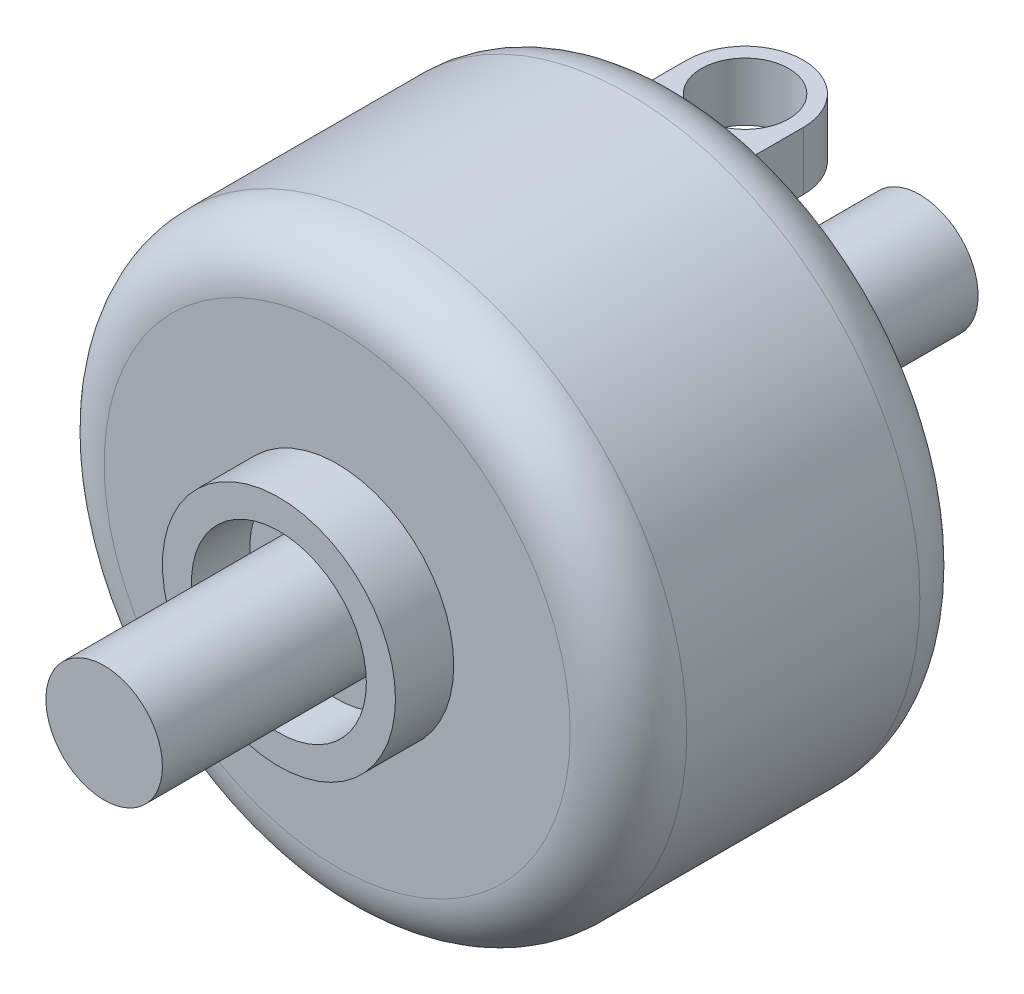
from build123d import *

# Parameters (mm, degrees)
SKETCH1_R           = 25
BOSS_EXTRUDE1_DEPTH = 30
SKETCH2_R           = 10
BOSS_EXTRUDE2_DEPTH = 20
SKETCH3_R           = 7.5
CUT_EXTRUDE1_DEPTH  = 20
SKETCH4_R           = 5
BOSS_EXTRUDE3_DEPTH = 20
BOSS_EXTRUDE4_START = 5
SKETCH5_R           = 10
BOSS_EXTRUDE4_DEPTH = 5
SKETCH7_W           = 10
SKETCH7_H           = 5
BOSS_EXTRUDE5_DEPTH = 10
SKETCH8_R           = 3.75
CUT_EXTRUDE2_DEPTH  = 5
CUT_EXTRUDE3_START  = -5
SKETCH9_R           = 3.75
CUT_EXTRUDE3_DEPTH  = 5
FILLET1_R           = 5
FILLET2_R           = 5
CUT_EXTRUDE4_START  = -15
SKETCH10_R          = 10
SKETCH10_R_2        = 7.5
CUT_EXTRUDE4_DEPTH  = 15
CUT_EXTRUDE5_START  = -5
SKETCH11_R          = 7.5
CUT_EXTRUDE5_DEPTH  = 5
BOSS_EXTRUDE6_START = 20
SKETCH12_R          = 5
BOSS_EXTRUDE6_DEPTH = 20


# Some blends are built 0.0001 mm under size
with BuildPart() as part:
    # Sketch1 → Boss-Extrude1 (new body)
    with BuildSketch(Plane.XY):
        Circle(SKETCH1_R)
    extrude(amount=BOSS_EXTRUDE1_DEPTH)

    # Sketch2 → Boss-Extrude2 (add)
    with BuildSketch(Plane.XY.offset(30)):
        Circle(SKETCH2_R)
    extrude(amount=BOSS_EXTRUDE2_DEPTH)

    # Sketch3 → Cut-Extrude1 (cut)
    with BuildSketch(Plane.XY.offset(50)):
        Circle(SKETCH3_R)
    extrude(amount=-CUT_EXTRUDE1_DEPTH, mode=Mode.SUBTRACT)

    # Sketch4 → Boss-Extrude3 (add)
    with BuildSketch(Plane.XY.offset(30)):
        Circle(SKETCH4_R)
    extrude(amount=BOSS_EXTRUDE3_DEPTH)

    # Sketch5 → Boss-Extrude4 (add)
    with BuildSketch(Plane(origin=(0, 0, 0), x_dir=(-1, 0, 0), z_dir=(0, 0, -1)).offset(BOSS_EXTRUDE4_START)):
        with Locations(Location((0, 0, 0), (0, 0, 180))):
            Circle(SKETCH5_R)
    extrude(amount=-BOSS_EXTRUDE4_DEPTH)

    # Sketch7 → Boss-Extrude5 (add)
    with BuildSketch(Plane(origin=(0, 0, 0), x_dir=(-1, 0, 0), z_dir=(0, 0, -1))):
        with Locations((0, 17.5)):
            Rectangle(SKETCH7_W, SKETCH7_H)
        with Locations((0, -17.5)):
            Rectangle(SKETCH7_W, SKETCH7_H)
    extrude(amount=BOSS_EXTRUDE5_DEPTH)

    # Sketch8 → Cut-Extrude2 (cut)
    with BuildSketch(Plane(origin=(0, 20, 0), x_dir=(1, 0, 0), z_dir=(0, 1, 0))):
        with Locations(Location((0, 5, 0), (0, 0, 180))):
            Circle(SKETCH8_R)
    extrude(amount=-CUT_EXTRUDE2_DEPTH, mode=Mode.SUBTRACT)

    # Sketch9 → Cut-Extrude3 (cut)
    with BuildSketch(Plane(origin=(0, -20, 0), x_dir=(-1, 0, 0), z_dir=(0, -1, 0)).offset(CUT_EXTRUDE3_START)):
        with Locations((0, 5)):
            Circle(SKETCH9_R)
    extrude(amount=CUT_EXTRUDE3_DEPTH, mode=Mode.SUBTRACT)

    # Fillet1
    # the kernel refuses this fillet: 5 mm, written as the material it takes off along each edge
    with BuildSketch(Plane(origin=(0, 0, 30), x_dir=(1, 0, 0), z_dir=(0, -1, 0))) as fillet1_piece_1:
        with BuildLine():
            CenterArc((25 - FILLET1_R, -FILLET1_R), FILLET1_R, 0, 90)
            Line((25 - FILLET1_R, 0), (25, 0))
            Line((25, 0), (25, -FILLET1_R))
        make_face()
    revolve(axis=Axis((0, 0, 30), (0, 0, 1)), mode=Mode.SUBTRACT)
    with BuildSketch(Plane(origin=(0, 0, 0), x_dir=(1, 0, 0), z_dir=(0, -1, 0))) as fillet1_piece_2_section:
        with BuildLine():
            CenterArc((25 - FILLET1_R, FILLET1_R), FILLET1_R, 270, 90)
            Line((25 - FILLET1_R, 0), (25, 0))
            Line((25, 0), (25, FILLET1_R))
        make_face()
    fillet1_piece_2 = revolve(axis=Axis((0, 0, 0), (0, 0, 1)), mode=Mode.PRIVATE)
    fillet1_piece_2 = split(fillet1_piece_2, bisect_by=Plane(origin=(5, 14.511659558, 1.419610571), z_dir=(1, 0, 0)), keep=Keep.TOP, mode=Mode.PRIVATE)
    add(fillet1_piece_2, mode=Mode.SUBTRACT)
    with BuildSketch(Plane(origin=(0, 0, 0), x_dir=(1, 0, 0), z_dir=(0, -1, 0))) as fillet1_piece_3_section:
        with BuildLine():
            CenterArc((25 - FILLET1_R, FILLET1_R), FILLET1_R, 270, 90)
            Line((25 - FILLET1_R, 0), (25, 0))
            Line((25, 0), (25, FILLET1_R))
        make_face()
    fillet1_piece_3 = revolve(axis=Axis((0, 0, 0), (0, 0, 1)), mode=Mode.PRIVATE)
    fillet1_piece_3 = split(fillet1_piece_3, bisect_by=Plane(origin=(4.6e-08, 20, 1.116734198), z_dir=(0, 1, 0)), keep=Keep.TOP, mode=Mode.PRIVATE)
    add(fillet1_piece_3, mode=Mode.SUBTRACT)
    with BuildSketch(Plane(origin=(0, 0, 0), x_dir=(1, 0, 0), z_dir=(0, -1, 0))) as fillet1_piece_4_section:
        with BuildLine():
            CenterArc((25 - FILLET1_R, FILLET1_R), FILLET1_R, 270, 90)
            Line((25 - FILLET1_R, 0), (25, 0))
            Line((25, 0), (25, FILLET1_R))
        make_face()
    fillet1_piece_4 = revolve(axis=Axis((0, 0, 0), (0, 0, 1)), mode=Mode.PRIVATE)
    fillet1_piece_4 = split(fillet1_piece_4, bisect_by=Plane(origin=(-4.6e-08, -20, 1.116734198), z_dir=(0, -1, 0)), keep=Keep.TOP, mode=Mode.PRIVATE)
    add(fillet1_piece_4, mode=Mode.SUBTRACT)
    with BuildSketch(Plane(origin=(0, 0, 0), x_dir=(1, 0, 0), z_dir=(0, -1, 0))) as fillet1_piece_5_section:
        with BuildLine():
            CenterArc((25 - FILLET1_R, FILLET1_R), FILLET1_R, 270, 90)
            Line((25 - FILLET1_R, 0), (25, 0))
            Line((25, 0), (25, FILLET1_R))
        make_face()
    fillet1_piece_5 = revolve(axis=Axis((0, 0, 0), (0, 0, 1)), mode=Mode.PRIVATE)
    fillet1_piece_5 = split(fillet1_piece_5, bisect_by=Plane(origin=(-5, 0, 1.419610538), z_dir=(-1, 0, 0)), keep=Keep.TOP, mode=Mode.PRIVATE)
    add(fillet1_piece_5, mode=Mode.SUBTRACT)

    # Fillet2
    fillet2_edges = [part.edges().sort_by_distance(p)[0] for p in [
        (5, -17.5, -10),
        (-5, -17.5, -10),
        (5, 17.5, -10),
        (-5, 17.5, -10),
    ]]
    fillet(fillet2_edges, radius=FILLET2_R - 0.0001)  # a hair under: the kernel refuses the full size

    # Sketch10 → Cut-Extrude4 (cut)
    with BuildSketch(Plane.XY.offset(50).offset(CUT_EXTRUDE4_START)):
        Circle(SKETCH10_R)
        Circle(SKETCH10_R_2, mode=Mode.SUBTRACT)
    extrude(amount=CUT_EXTRUDE4_DEPTH, mode=Mode.SUBTRACT)

    # Sketch11 → Cut-Extrude5 (cut)
    with BuildSketch(Plane(origin=(0, 0, -5), x_dir=(-1, 0, 0), z_dir=(0, 0, -1)).offset(CUT_EXTRUDE5_START)):
        with Locations(Location((0, 0, 0), (0, 0, 180))):
            Circle(SKETCH11_R)
    extrude(amount=CUT_EXTRUDE5_DEPTH, mode=Mode.SUBTRACT)

    # Sketch12 → Boss-Extrude6 (add)
    with BuildSketch(Plane(origin=(0, 0, 0), x_dir=(-1, 0, 0), z_dir=(0, 0, -1)).offset(BOSS_EXTRUDE6_START)):
        with Locations(Location((0, 0, 0), (0, 0, 180))):
            Circle(SKETCH12_R)
    extrude(amount=-BOSS_EXTRUDE6_DEPTH)


solid = part.part
